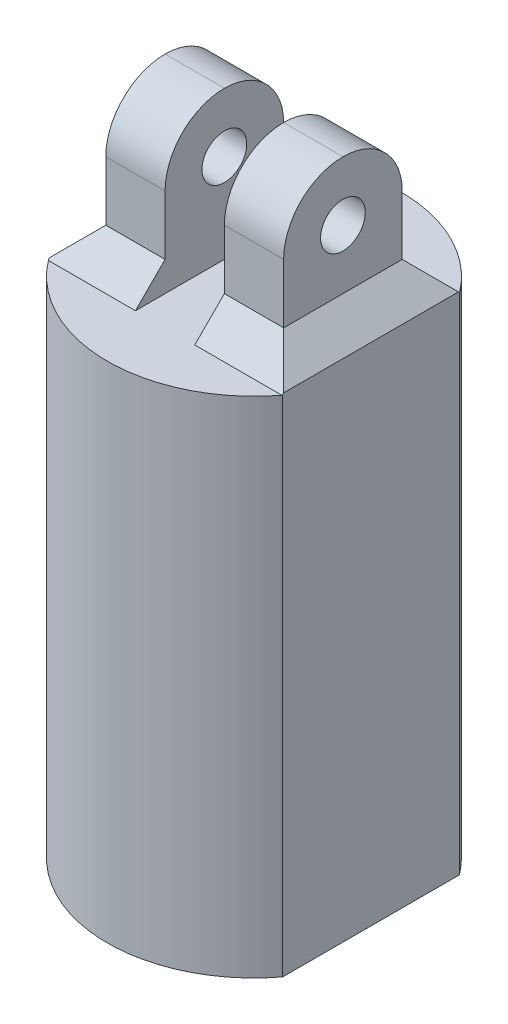
from build123d import *

# Parameters (mm, degrees)
BOSS_EXTRUDE1_DEPTH = 34
SKETCH7_W           = 4
SKETCH7_H           = 8
BOSS_EXTRUDE3_DEPTH = 10
SKETCH9_R           = 1.51
CUT_EXTRUDE5_DEPTH  = 48.193431746
FILLET2_R           = 4
SKETCH16_R          = 1.5
CUT_EXTRUDE7_DEPTH  = 30
CHAMFER1_SIZE       = 2


# Some blends are built 0.0001 mm under size
with BuildPart() as part:
    # Sketch1 → Boss-Extrude1 (new body)
    with BuildSketch(Plane(origin=(0, 0, 0), x_dir=(1, 0, 0), z_dir=(0, 1, 0))):
        with BuildLine():
            Line((-7.9, 5.966573556), (-7.9, -5.966573556))
            ThreePointArc((-7.9, -5.966573556), (0, -9.9), (7.9, -5.966573556))
            Line((7.9, -5.966573556), (7.9, 5.966573556))
            ThreePointArc((7.9, 5.966573556), (0, 9.9), (-7.9, 5.966573556))
        make_face()
    extrude(amount=BOSS_EXTRUDE1_DEPTH)

    # Sketch7 → Boss-Extrude3 (add)
    with BuildSketch(Plane(origin=(0, 34, 0), x_dir=(1, 0, 0), z_dir=(0, 1, 0))):
        with Locations((-4, 0)):
            Rectangle(SKETCH7_W, SKETCH7_H)
        with Locations((4, 0)):
            Rectangle(SKETCH7_W, SKETCH7_H)
    extrude(amount=BOSS_EXTRUDE3_DEPTH)

    # Sketch9 → Cut-Extrude5 (cut, through all)
    with BuildSketch(Plane(origin=(6, 0, 0), x_dir=(0, 0, -1), z_dir=(1, 0, 0))):
        with Locations((0, 40)):
            Circle(SKETCH9_R)
    extrude(amount=-CUT_EXTRUDE5_DEPTH, mode=Mode.SUBTRACT)

    # Fillet2
    fillet2_edges = [part.edges().sort_by_distance(p)[0] for p in [
        (4, 44, 4),
        (4, 44, -4),
        (-4, 44, -4),
        (-4, 44, 4),
    ]]
    fillet(fillet2_edges, radius=FILLET2_R - 0.0001)  # a hair under: the kernel refuses the full size

    # Sketch16 → Cut-Extrude7 (cut)
    with BuildSketch(Plane.XZ):
        with Locations(Location((0, 0, 0), (0, 0, 270))):
            Circle(SKETCH16_R)
    extrude(amount=-CUT_EXTRUDE7_DEPTH, mode=Mode.SUBTRACT)

    # Chamfer1
    # the kernel refuses this chamfer: 2 mm, written as the material it adds along each edge
    with BuildSketch(Plane(origin=(-6, 34, -4), x_dir=(0, -0.027495876610585623, -0.9996219169112968), z_dir=(1, 0, 0)), Plane(origin=(2, 34, -4), x_dir=(0, -0.027495876610585623, -0.9996219169112968), z_dir=(1, 0, 0)), Plane(origin=(6, 34, 4), x_dir=(0, -0.027495876610585623, 0.9996219169112968), z_dir=(-1, 0, 0))) as chamfer1_piece_1:
        Polygon((CHAMFER1_SIZE * 0.999621916911, CHAMFER1_SIZE * 0.0274958766106), (-CHAMFER1_SIZE * 0.0274958766106, CHAMFER1_SIZE * 0.999621916911), (0, 0), align=None)
    extrude(amount=4)
    with BuildSketch(Plane(origin=(-6, 34, -4), x_dir=(0, -0.027495876610585623, -0.9996219169112968), z_dir=(1, 0, 0))) as chamfer1_piece_2_section:
        Polygon((CHAMFER1_SIZE * 0.999621916911, CHAMFER1_SIZE * 0.0274958766106), (-CHAMFER1_SIZE * 0.0274958766106, CHAMFER1_SIZE * 0.999621916911), (0, 0), align=None)
    chamfer1_piece_2 = extrude(amount=9.143365976, mode=Mode.PRIVATE)
    chamfer1_piece_2 = split(chamfer1_piece_2, bisect_by=Plane(origin=(2, 34.659587254, -4.659587254), z_dir=(1, 0, 0)), keep=Keep.TOP, mode=Mode.PRIVATE)
    add(chamfer1_piece_2)
    with BuildSketch(Plane(origin=(-6, 34, 4), x_dir=(0.02749587661058651, 0.9996219169112968, 0), z_dir=(0, 0, -1))) as chamfer1_piece_3_section:
        Polygon((CHAMFER1_SIZE * 0.999621916911, -CHAMFER1_SIZE * 0.0274958766106), (-CHAMFER1_SIZE * 0.0274958766106, -CHAMFER1_SIZE * 0.999621916911), (0, 0), align=None)
    chamfer1_piece_3 = extrude(amount=8, mode=Mode.PRIVATE)
    chamfer1_piece_3 = split(chamfer1_piece_3, bisect_by=Plane(origin=(-7.9, 34.66508919, 0), z_dir=(1, 0, 0)), keep=Keep.TOP, mode=Mode.PRIVATE)
    add(chamfer1_piece_3)
    with BuildSketch(Plane(origin=(3.143365976, 34, 4), x_dir=(0, 0.9996219169112968, -0.027495876610586296), z_dir=(-1, 0, 0))) as chamfer1_piece_4_section:
        Polygon((CHAMFER1_SIZE * 0.999621916911, -CHAMFER1_SIZE * 0.0274958766106), (-CHAMFER1_SIZE * 0.0274958766106, -CHAMFER1_SIZE * 0.999621916911), (0, 0), align=None)
    chamfer1_piece_4 = extrude(amount=9.143365976, mode=Mode.PRIVATE)
    chamfer1_piece_4 = split(chamfer1_piece_4, bisect_by=Plane(origin=(2, 34.659587254, 4.659587254), z_dir=(1, 0, 0)), keep=Keep.TOP, mode=Mode.PRIVATE)
    add(chamfer1_piece_4)
    with BuildSketch(Plane(origin=(-2, 34, 4), x_dir=(0, 0.9996219169112968, -0.027495876610586296), z_dir=(-1, 0, 0))) as chamfer1_piece_5:
        Polygon((CHAMFER1_SIZE * 0.999621916911, -CHAMFER1_SIZE * 0.0274958766106), (-CHAMFER1_SIZE * 0.0274958766106, -CHAMFER1_SIZE * 0.999621916911), (0, 0), align=None)
    extrude(amount=4)
    with BuildSketch(Plane(origin=(-3.143365976, 34, -4), x_dir=(0, -0.027495876610585623, -0.9996219169112968), z_dir=(1, 0, 0))) as chamfer1_piece_6_section:
        Polygon((CHAMFER1_SIZE * 0.999621916911, CHAMFER1_SIZE * 0.0274958766106), (-CHAMFER1_SIZE * 0.0274958766106, CHAMFER1_SIZE * 0.999621916911), (0, 0), align=None)
    chamfer1_piece_6 = extrude(amount=9.143365976, mode=Mode.PRIVATE)
    chamfer1_piece_6 = split(chamfer1_piece_6, bisect_by=Plane(origin=(-2, 34.659587254, -4.659587254), z_dir=(-1, 0, 0)), keep=Keep.TOP, mode=Mode.PRIVATE)
    add(chamfer1_piece_6)
    with BuildSketch(Plane(origin=(6, 34, 4), x_dir=(0, -0.027495876610585623, 0.9996219169112968), z_dir=(-1, 0, 0))) as chamfer1_piece_7_section:
        Polygon((CHAMFER1_SIZE * 0.999621916911, CHAMFER1_SIZE * 0.0274958766106), (-CHAMFER1_SIZE * 0.0274958766106, CHAMFER1_SIZE * 0.999621916911), (0, 0), align=None)
    chamfer1_piece_7 = extrude(amount=9.143365976, mode=Mode.PRIVATE)
    chamfer1_piece_7 = split(chamfer1_piece_7, bisect_by=Plane(origin=(-2, 34.659587254, 4.659587254), z_dir=(-1, 0, 0)), keep=Keep.TOP, mode=Mode.PRIVATE)
    add(chamfer1_piece_7)
    with BuildSketch(Plane(origin=(6, 34, -4), x_dir=(0.9996219169112968, -0.027495876610585623, 0), z_dir=(0, 0, 1))) as chamfer1_piece_8_section:
        Polygon((CHAMFER1_SIZE * 0.999621916911, CHAMFER1_SIZE * 0.0274958766106), (-CHAMFER1_SIZE * 0.0274958766106, CHAMFER1_SIZE * 0.999621916911), (0, 0), align=None)
    chamfer1_piece_8 = extrude(amount=8, mode=Mode.PRIVATE)
    chamfer1_piece_8 = split(chamfer1_piece_8, bisect_by=Plane(origin=(7.9, 34.66508919, 0), z_dir=(-1, 0, 0)), keep=Keep.TOP, mode=Mode.PRIVATE)
    add(chamfer1_piece_8)
    with BuildSketch(Plane(origin=(-6, 34, 4), x_dir=(0.02749587661058651, 0.9996219169112968, 0), z_dir=(0, 0, -1))) as chamfer1_piece_9a_section:
        Polygon((CHAMFER1_SIZE * 0.999621916911, -CHAMFER1_SIZE * 0.0274958766106), (-CHAMFER1_SIZE * 0.0274958766106, -CHAMFER1_SIZE * 0.999621916911), (0, 0), align=None)
    chamfer1_piece_9a = extrude(amount=13.143365976, mode=Mode.PRIVATE)
    chamfer1_piece_9a = split(chamfer1_piece_9a, bisect_by=Plane(origin=(-6.579477658, 34.702229701, -4), z_dir=(0, 0, -1)), keep=Keep.TOP, mode=Mode.PRIVATE)
    chamfer1_piece_9a = chamfer1_piece_9a & Plane(origin=(0, 34.702229701, 0), x_dir=(-0.7979797979797981, 0, 0.6026841975828805), z_dir=(0, -1, 0)) * Cylinder(9.9, 35, mode=Mode.PRIVATE)
    chamfer1_piece_9a = split(chamfer1_piece_9a, bisect_by=Plane(origin=(-7.9, 34.702229701, -5.684853753), z_dir=(1, 0, 0)), keep=Keep.TOP, mode=Mode.PRIVATE)
    with BuildSketch(Plane(origin=(-11.143365976, 34, -4), x_dir=(0, -0.027495876610585623, -0.9996219169112968), z_dir=(1, 0, 0))) as chamfer1_piece_9b_section:
        Polygon((CHAMFER1_SIZE * 0.999621916911, CHAMFER1_SIZE * 0.0274958766106), (-CHAMFER1_SIZE * 0.0274958766106, CHAMFER1_SIZE * 0.999621916911), (0, 0), align=None)
    chamfer1_piece_9b = extrude(amount=9.143365976, mode=Mode.PRIVATE)
    chamfer1_piece_9b = split(chamfer1_piece_9b, bisect_by=Plane(origin=(-6, 34.659622918, -4.659519528), z_dir=(-1, 0, 0)), keep=Keep.TOP, mode=Mode.PRIVATE)
    chamfer1_piece_9b = split(chamfer1_piece_9b, bisect_by=Plane(origin=(-7.9, 34.659622918, -4.659519528), z_dir=(1, 0, 0)), keep=Keep.TOP, mode=Mode.PRIVATE)
    chamfer1_piece_9b = chamfer1_piece_9b & Plane(origin=(0, 34.659622918, 0), x_dir=(0.7979797979797981, 0, -0.6026841975828805), z_dir=(0, -1, 0)) * Cylinder(9.9, 27, mode=Mode.PRIVATE)
    chamfer1_piece_9 = chamfer1_piece_9a & chamfer1_piece_9b
    add(chamfer1_piece_9)
    with BuildSketch(Plane(origin=(-6, 34, 9.143365976), x_dir=(0.02749587661058651, 0.9996219169112968, 0), z_dir=(0, 0, -1))) as chamfer1_piece_10a_section:
        Polygon((CHAMFER1_SIZE * 0.999621916911, -CHAMFER1_SIZE * 0.0274958766106), (-CHAMFER1_SIZE * 0.0274958766106, -CHAMFER1_SIZE * 0.999621916911), (0, 0), align=None)
    chamfer1_piece_10a = extrude(amount=13.143365976, mode=Mode.PRIVATE)
    chamfer1_piece_10a = split(chamfer1_piece_10a, bisect_by=Plane(origin=(-6.579477657, 34.702229707, 4), z_dir=(0, 0, 1)), keep=Keep.TOP, mode=Mode.PRIVATE)
    chamfer1_piece_10a = chamfer1_piece_10a & Plane(origin=(0, 34.702229707, 0), x_dir=(-0.7979797979797981, 0, 0.6026841975828805), z_dir=(0, -1, 0)) * Cylinder(9.9, 35, mode=Mode.PRIVATE)
    chamfer1_piece_10a = split(chamfer1_piece_10a, bisect_by=Plane(origin=(-7.9, 34.702229707, 5.684853748), z_dir=(1, 0, 0)), keep=Keep.TOP, mode=Mode.PRIVATE)
    with BuildSketch(Plane(origin=(-2, 34, 4), x_dir=(0, 0.9996219169112968, -0.027495876610586296), z_dir=(-1, 0, 0))) as chamfer1_piece_10b_section:
        Polygon((CHAMFER1_SIZE * 0.999621916911, -CHAMFER1_SIZE * 0.0274958766106), (-CHAMFER1_SIZE * 0.0274958766106, -CHAMFER1_SIZE * 0.999621916911), (0, 0), align=None)
    chamfer1_piece_10b = extrude(amount=9.143365976, mode=Mode.PRIVATE)
    chamfer1_piece_10b = split(chamfer1_piece_10b, bisect_by=Plane(origin=(-6, 34.659622918, 4.659519528), z_dir=(-1, 0, 0)), keep=Keep.TOP, mode=Mode.PRIVATE)
    chamfer1_piece_10b = chamfer1_piece_10b & Plane(origin=(0, 34.659622918, 0), x_dir=(-0.7979797979797981, 0, 0.6026841975828805), z_dir=(0, -1, 0)) * Cylinder(9.9, 27, mode=Mode.PRIVATE)
    chamfer1_piece_10b = split(chamfer1_piece_10b, bisect_by=Plane(origin=(-7.9, 34.659622918, 4.659519528), z_dir=(1, 0, 0)), keep=Keep.TOP, mode=Mode.PRIVATE)
    chamfer1_piece_10 = chamfer1_piece_10a & chamfer1_piece_10b
    add(chamfer1_piece_10)
    with BuildSketch(Plane(origin=(6, 34, -9.143365976), x_dir=(0.9996219169112968, -0.027495876610585623, 0), z_dir=(0, 0, 1))) as chamfer1_piece_11a_section:
        Polygon((CHAMFER1_SIZE * 0.999621916911, CHAMFER1_SIZE * 0.0274958766106), (-CHAMFER1_SIZE * 0.0274958766106, CHAMFER1_SIZE * 0.999621916911), (0, 0), align=None)
    chamfer1_piece_11a = extrude(amount=13.143365976, mode=Mode.PRIVATE)
    chamfer1_piece_11a = chamfer1_piece_11a & Plane(origin=(0, 34.702229706, 0), x_dir=(-0.7979797979797981, 0, 0.6026841975828805), z_dir=(0, -1, 0)) * Cylinder(9.9, 35, mode=Mode.PRIVATE)
    chamfer1_piece_11a = split(chamfer1_piece_11a, bisect_by=Plane(origin=(7.9, 34.702229706, -5.684853749), z_dir=(-1, 0, 0)), keep=Keep.TOP, mode=Mode.PRIVATE)
    chamfer1_piece_11a = split(chamfer1_piece_11a, bisect_by=Plane(origin=(6.579477658, 34.702229706, -4), z_dir=(0, 0, -1)), keep=Keep.TOP, mode=Mode.PRIVATE)
    with BuildSketch(Plane(origin=(2, 34, -4), x_dir=(0, -0.027495876610585623, -0.9996219169112968), z_dir=(1, 0, 0))) as chamfer1_piece_11b_section:
        Polygon((CHAMFER1_SIZE * 0.999621916911, CHAMFER1_SIZE * 0.0274958766106), (-CHAMFER1_SIZE * 0.0274958766106, CHAMFER1_SIZE * 0.999621916911), (0, 0), align=None)
    chamfer1_piece_11b = extrude(amount=9.143365976, mode=Mode.PRIVATE)
    chamfer1_piece_11b = split(chamfer1_piece_11b, bisect_by=Plane(origin=(7.9, 34.659622918, -4.659519528), z_dir=(-1, 0, 0)), keep=Keep.TOP, mode=Mode.PRIVATE)
    chamfer1_piece_11b = chamfer1_piece_11b & Plane(origin=(0, 34.659622918, 0), x_dir=(0.7979797979797981, 0, -0.6026841975828805), z_dir=(0, -1, 0)) * Cylinder(9.9, 27, mode=Mode.PRIVATE)
    chamfer1_piece_11b = split(chamfer1_piece_11b, bisect_by=Plane(origin=(6, 34.659622918, -4.659519528), z_dir=(1, 0, 0)), keep=Keep.TOP, mode=Mode.PRIVATE)
    chamfer1_piece_11 = chamfer1_piece_11a & chamfer1_piece_11b
    add(chamfer1_piece_11)
    with BuildSketch(Plane(origin=(11.143365976, 34, 4), x_dir=(0, -0.027495876610585623, 0.9996219169112968), z_dir=(-1, 0, 0))) as chamfer1_piece_12a_section:
        Polygon((CHAMFER1_SIZE * 0.999621916911, CHAMFER1_SIZE * 0.0274958766106), (-CHAMFER1_SIZE * 0.0274958766106, CHAMFER1_SIZE * 0.999621916911), (0, 0), align=None)
    chamfer1_piece_12a = extrude(amount=9.143365976, mode=Mode.PRIVATE)
    chamfer1_piece_12a = chamfer1_piece_12a & Plane(origin=(0, 34.659622918, 0), x_dir=(-0.7979797979797981, 0, 0.6026841975828805), z_dir=(0, -1, 0)) * Cylinder(9.9, 27, mode=Mode.PRIVATE)
    chamfer1_piece_12a = split(chamfer1_piece_12a, bisect_by=Plane(origin=(7.9, 34.659622918, 4.659519528), z_dir=(-1, 0, 0)), keep=Keep.TOP, mode=Mode.PRIVATE)
    chamfer1_piece_12a = split(chamfer1_piece_12a, bisect_by=Plane(origin=(6, 34.659622918, 4.659519528), z_dir=(1, 0, 0)), keep=Keep.TOP, mode=Mode.PRIVATE)
    with BuildSketch(Plane(origin=(6, 34, -4), x_dir=(0.9996219169112968, -0.027495876610585623, 0), z_dir=(0, 0, 1))) as chamfer1_piece_12b_section:
        Polygon((CHAMFER1_SIZE * 0.999621916911, CHAMFER1_SIZE * 0.0274958766106), (-CHAMFER1_SIZE * 0.0274958766106, CHAMFER1_SIZE * 0.999621916911), (0, 0), align=None)
    chamfer1_piece_12b = extrude(amount=13.143365976, mode=Mode.PRIVATE)
    chamfer1_piece_12b = chamfer1_piece_12b & Plane(origin=(0, 34.702229701, 0), x_dir=(-0.7979797979797981, 0, 0.6026841975828805), z_dir=(0, -1, 0)) * Cylinder(9.9, 35, mode=Mode.PRIVATE)
    chamfer1_piece_12b = split(chamfer1_piece_12b, bisect_by=Plane(origin=(7.9, 34.702229701, 5.684853753), z_dir=(-1, 0, 0)), keep=Keep.TOP, mode=Mode.PRIVATE)
    chamfer1_piece_12b = split(chamfer1_piece_12b, bisect_by=Plane(origin=(6.579477658, 34.702229701, 4), z_dir=(0, 0, 1)), keep=Keep.TOP, mode=Mode.PRIVATE)
    chamfer1_piece_12 = chamfer1_piece_12a & chamfer1_piece_12b
    add(chamfer1_piece_12)


solid = part.part
